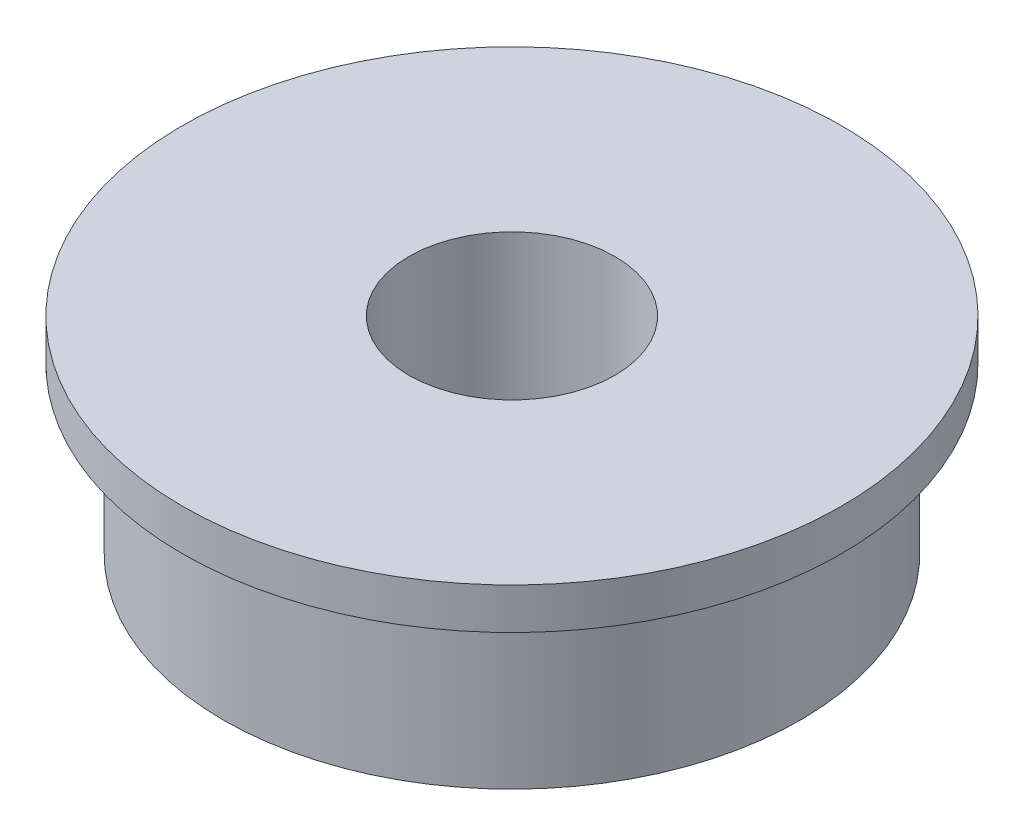
from build123d import *

# Parameters (mm, degrees)
SKETCH_1_R      = 7
SKETCH_1_R_2    = 2.5
EXTRUDE_1_DEPTH = 5
SKETCH_2_R      = 8
SKETCH_2_R_2    = 5.723236362
EXTRUDE_2_DEPTH = 1


with BuildPart() as part:
    # 스케치1 → 보스-돌출1 (new body)
    with BuildSketch(Plane(origin=(0, 0, 0), x_dir=(1, 0, 0), z_dir=(0, 1, 0))):
        Circle(SKETCH_1_R)
        Circle(SKETCH_1_R_2, mode=Mode.SUBTRACT)
    extrude(amount=EXTRUDE_1_DEPTH)

    # 스케치2 → 보스-돌출2 (add)
    with BuildSketch(Plane(origin=(0, 5, 0), x_dir=(1, 0, 0), z_dir=(0, 1, 0))):
        Circle(SKETCH_2_R)
        Circle(SKETCH_2_R_2, mode=Mode.SUBTRACT)
    extrude(amount=-EXTRUDE_2_DEPTH)


solid = part.part
